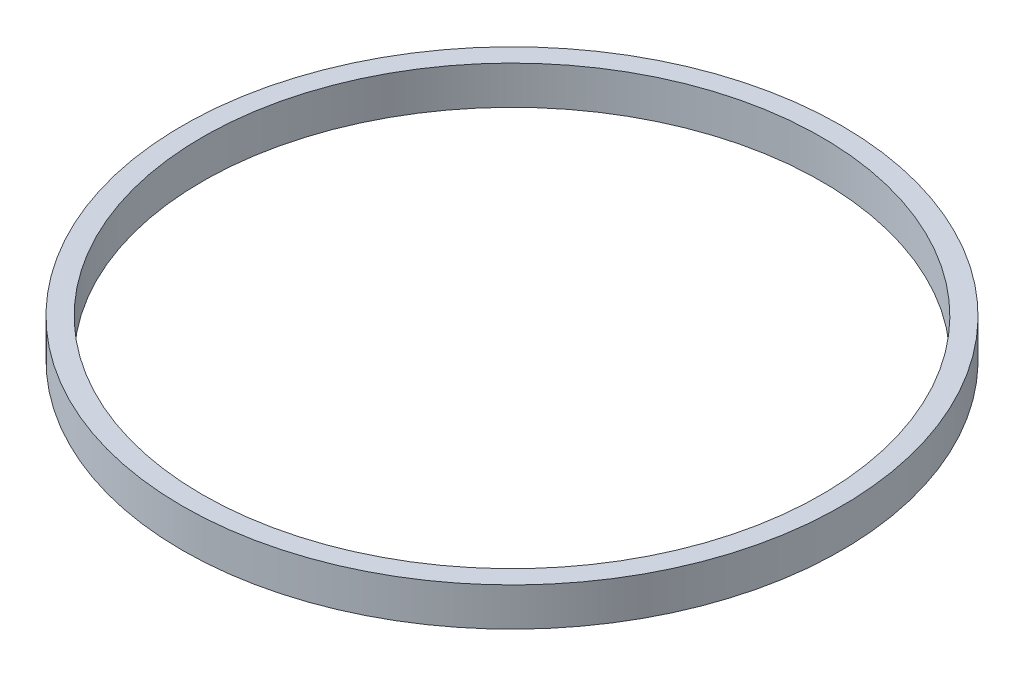
from build123d import *

# Parameters (mm, degrees)
SKETCH1_R           = 21.5
SKETCH1_R_2         = 20.2
BOSS_EXTRUDE1_DEPTH = 2.5


with BuildPart() as part:
    # Sketch1 → Boss-Extrude1 (new body)
    with BuildSketch(Plane(origin=(0, 0, 0), x_dir=(1, 0, 0), z_dir=(0, 1, 0))):
        Circle(SKETCH1_R)
        Circle(SKETCH1_R_2, mode=Mode.SUBTRACT)
    extrude(amount=BOSS_EXTRUDE1_DEPTH)


solid = part.part
